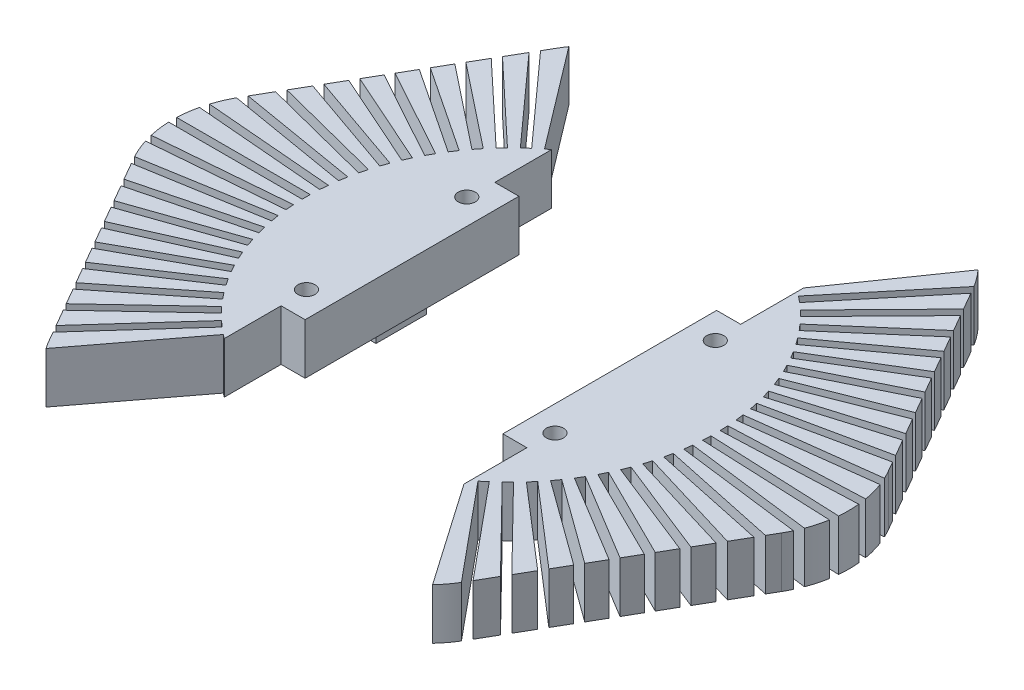
from build123d import *

# Parameters (mm, degrees)
BOSS_EXTRUDE2_DEPTH = 77.5
SKETCH6_R           = 13
CUT_EXTRUDE1_DEPTH  = 77.5
CUT_EXTRUDE2_DEPTH  = 0.75
CIRPATTERN1_COUNT   = 75
SKETCH9_OUTSIDE_W   = 166.142
SKETCH9_OUTSIDE_H   = 154.554
CUT_EXTRUDE3_DEPTH  = 63
SKETCH12_W          = 156.863178834
SKETCH12_H          = 134.026059834
CUT_EXTRUDE7_DEPTH  = 68
CUT_EXTRUDE9_DEPTH  = 60
SKETCH14_W          = 5.5
SKETCH14_H          = 9.5
BOSS_EXTRUDE3_DEPTH = 3
SKETCH15_R          = 1.6
CUT_EXTRUDE10_DEPTH = 9.5


with BuildPart() as part:
    # Sketch1 → Boss-Extrude2 (new body)
    with BuildSketch(Plane(origin=(0, 0, 0), x_dir=(1, 0, 0), z_dir=(0, 1, 0))):
        with BuildLine():
            Line((60.621778265, 10), (38.97114317, 47.5))
            ThreePointArc((38.97114317, 47.5), (31.650635095, 54.820508076), (21.650635095, 57.5))
            Line((21.650635095, 57.5), (-21.650635095, 57.5))
            ThreePointArc((-21.650635095, 57.5), (-31.650635095, 54.820508076), (-38.97114317, 47.5))
            Line((-38.97114317, 47.5), (-60.621778265, 10))
            ThreePointArc((-60.621778265, 10), (-63.301270189, 0), (-60.621778265, -10))
            Line((-60.621778265, -10), (-38.97114317, -47.5))
            ThreePointArc((-38.97114317, -47.5), (-31.650635095, -54.820508076), (-21.650635095, -57.5))
            Line((-21.650635095, -57.5), (21.650635095, -57.5))
            ThreePointArc((21.650635095, -57.5), (31.650635095, -54.820508076), (38.97114317, -47.5))
            Line((38.97114317, -47.5), (60.621778265, -10))
            ThreePointArc((60.621778265, -10), (63.301270189, 0), (60.621778265, 10))
        make_face()
    extrude(amount=BOSS_EXTRUDE2_DEPTH)

    # Sketch6 → Cut-Extrude1 (cut)
    with BuildSketch(Plane(origin=(0, 77.5, 0), x_dir=(1, 0, 0), z_dir=(0, 1, 0))):
        with Locations(Location((0, 0, 0), (0, 0, 270))):
            Circle(SKETCH6_R)
    extrude(amount=-CUT_EXTRUDE1_DEPTH, mode=Mode.SUBTRACT)

    # Sketch7 → Cut-Revolve1 (revolve, cut)
    with BuildSketch(Plane.XY, mode=Mode.PRIVATE) as cut_revolve1_sk:
        with BuildLine():
            Line((13, 77.5), (13, 60))
            add(Edge.make_bspline(
                [(13, 60), (14.00368376, 72.891944156), (30.5, 77.5)],
                knots=[0, 0, 0, 1, 1, 1], degree=2))
            Line((30.5, 77.5), (13, 77.5))
        make_face()
        with BuildLine():
            Line((64.942286341, 77.5), (47.442286341, 77.5))
            add(Edge.make_bspline(
                [(64.942286341, 60), (63.93860258, 72.891944156), (47.442286341, 77.5)],
                knots=[0, 0, 0, 1, 1, 1], degree=2))
            Line((64.942286341, 60), (64.942286341, 77.5))
        make_face()
    revolve(cut_revolve1_sk.sketch.rotate(Axis((0, 77.5, 0), (0, -1, 0)), 90), axis=Axis((0, 77.5, 0), (0, -1, 0)), mode=Mode.SUBTRACT)

    # Sketch8 → Cut-Extrude2 (cut, symmetric)
    with BuildSketch(Plane.XY):
        Polygon((-63.301270189, 77.5), (-63.301270189, 0), (-38.301270189, 0), (-38.301270189, 5), (-38.301270189, 72.5), (-13.301270189, 72.5), (-13.301270189, 77.5), align=None)
    cut_extrude2 = extrude(amount=CUT_EXTRUDE2_DEPTH, both=True, mode=Mode.SUBTRACT)

    # CirPattern1: Cut-Extrude2 ×75 about axis
    cirpattern1_axis = Axis((0, 0, 0), (0, 1, 0))
    for i in range(1, CIRPATTERN1_COUNT):
        add(cut_extrude2.rotate(cirpattern1_axis, i * 360 / CIRPATTERN1_COUNT), mode=Mode.SUBTRACT)

    # Sketch9 outside → Cut-Extrude3 (cut)
    with BuildSketch(Plane(origin=(0, 77.5, 0), x_dir=(1, 0, 0), z_dir=(0, 1, 0))):
        with Locations((0.007, 0)):
            Rectangle(SKETCH9_OUTSIDE_W, SKETCH9_OUTSIDE_H)
        Polygon((51.961524227, 0), (25.980762114, 45), (-25.980762114, 45), (-51.961524227, 0), (-25.980762114, -45), (25.980762114, -45), align=None, mode=Mode.SUBTRACT)
    extrude(amount=-CUT_EXTRUDE3_DEPTH, mode=Mode.SUBTRACT)

    # Sketch12 → Cut-Extrude7 (cut)
    with BuildSketch(Plane(origin=(0, 77.5, 0), x_dir=(1, 0, 0), z_dir=(0, 1, 0))):
        Rectangle(SKETCH12_W, SKETCH12_H)
    extrude(amount=-CUT_EXTRUDE7_DEPTH, mode=Mode.SUBTRACT)

    # Sketch11 → Cut-Extrude9 (cut)
    with BuildSketch(Plane.XZ):
        Polygon((-23, 20), (-18.5, 20), (-18.5, -20), (-23, -20), (-23, -67.650278953), (23, -67.650278953), (23, -20), (18.5, -20), (18.5, 20), (23, 20), (23, 67.650278953), (-23, 67.650278953), align=None)
    extrude(amount=-CUT_EXTRUDE9_DEPTH, mode=Mode.SUBTRACT)


with BuildPart() as cut_extrude9_piece_1:
    # of the separate pieces the step leaves, piece 1, a body of its own (cut_extrude9_pieces_kept)
    add(part.part.solids().sort_by_distance((23, 0, 20))[0])



with BuildPart() as cut_extrude9_piece_2:
    # of the separate pieces the step leaves, piece 2, a body of its own (cut_extrude9_pieces_kept)
    add(part.part.solids().sort_by_distance((-60.088396836, 0, 10.923843735))[0])


with BuildPart() as cut_extrude9_piece_1_1:
    add(cut_extrude9_piece_1.part)

    add(cut_extrude9_piece_2.part)  # Boss-Extrude3 merges Cut-Extrude9 piece 2
    # Sketch14 → Boss-Extrude3 (add)
    with BuildSketch(Plane.XZ):
        with Locations((-23.25, 0)):
            Rectangle(SKETCH14_W, SKETCH14_H)
        with Locations((23.25, 0)):
            Rectangle(SKETCH14_W, SKETCH14_H)
    extrude(amount=BOSS_EXTRUDE3_DEPTH)

    # Sketch15 → Cut-Extrude10 (cut)
    with BuildSketch(Plane.XZ):
        with Locations(Location((-23.25, 15, 0), (0, 0, 270))):
            Circle(SKETCH15_R)
        with Locations(Location((-23.25, -15, 0), (0, 0, 270))):
            Circle(SKETCH15_R)
        with Locations(Location((23.25, -15, 0), (0, 0, 270))):
            Circle(SKETCH15_R)
        with Locations(Location((23.25, 15, 0), (0, 0, 270))):
            Circle(SKETCH15_R)
    extrude(amount=-CUT_EXTRUDE10_DEPTH, mode=Mode.SUBTRACT)


solid = cut_extrude9_piece_1_1.part
